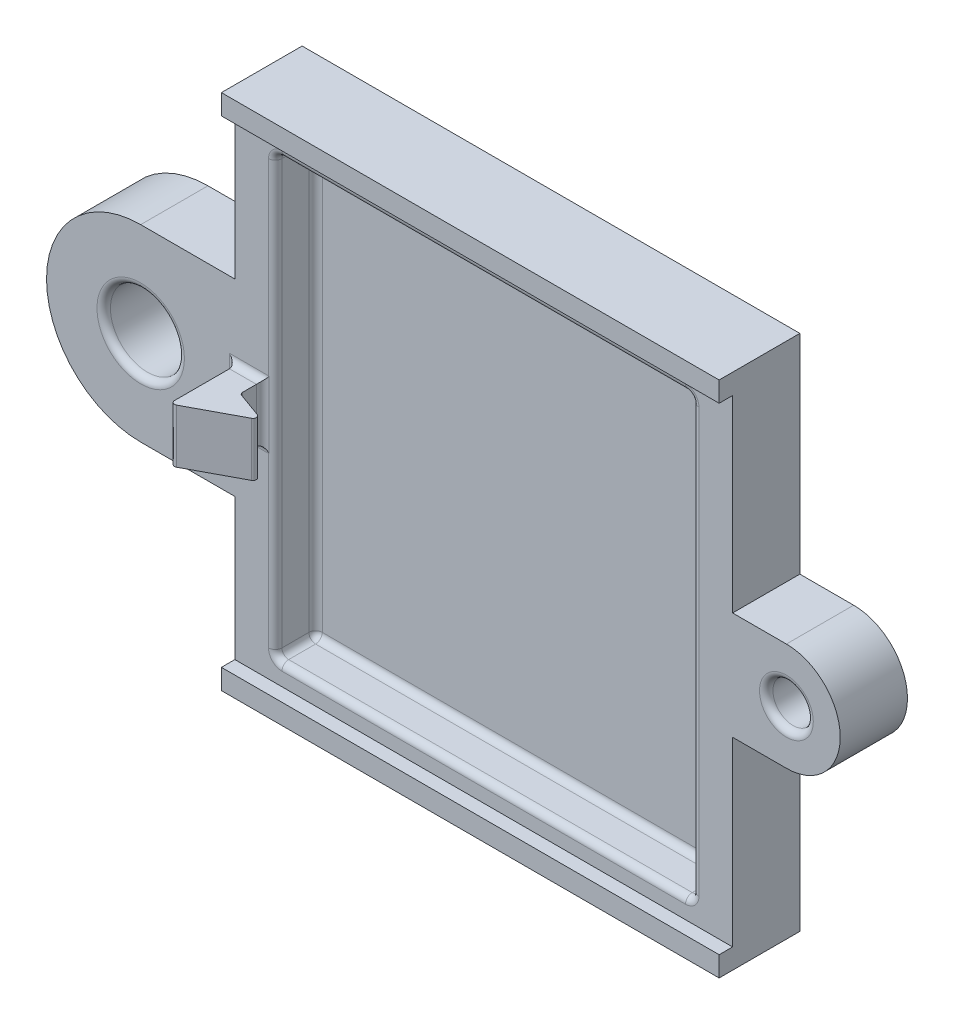
from build123d import *

# Parameters (mm, degrees)
SKETCH1_W                = 38.5
SKETCH1_H                = 37
BOSS_EXTRUDE1_DEPTH      = 5
SKETCH2_W                = 31
SKETCH2_H                = 32.5
CUT_EXTRUDE1_DEPTH       = 3
SKETCH9_R                = 1.5
SKETCH9_R_2              = 2.75
BOSS_EXTRUDE4_DEPTH      = 5
SKETCH10_W               = 37
SKETCH10_H               = 1.5
BOSS_EXTRUDE5_DEPTH      = 1
BOSS_EXTRUDE7_DEPTH      = 1.5
BOSS_EXTRUDE7_DEPTH_BACK = 2.5
FILLET2_R                = 0.5
FILLET4_R                = 0.5
FILLET7_R                = 0.5
FILLET10_R               = 0.5
FILLET11_R               = 0.5
FILLET12_R               = 0.5


with BuildPart() as part:
    # Sketch1 → Boss-Extrude1 (new body)
    with BuildSketch(Plane(origin=(0, 0, 0), x_dir=(0, 1, 0), z_dir=(0, 0, 1))):
        with Locations((0.230791095, 5.386953358)):
            Rectangle(SKETCH1_W, SKETCH1_H)
    extrude(amount=BOSS_EXTRUDE1_DEPTH)

    # Sketch2 → Cut-Extrude1 (cut)
    with BuildSketch(Plane.XY.offset(5)):
        with Locations((-5.386953358, 0.230791095)):
            Rectangle(SKETCH2_W, SKETCH2_H)
    extrude(amount=-CUT_EXTRUDE1_DEPTH, mode=Mode.SUBTRACT)

    # Sketch9 → Boss-Extrude4 (add)
    # profile 1 of 2: a face of its own
    with BuildSketch(Plane(origin=(0, 0, 0), x_dir=(1, 0, 0), z_dir=(0, 0, -1))):
        with BuildLine():
            Line((17.113046642, 4.019208905), (13.113046642, 4.019208905))
            Line((13.113046642, 4.019208905), (13.113046642, -3.980791095))
            Line((13.113046642, -3.980791095), (17.113046642, -3.980791095))
            ThreePointArc((17.113046642, -3.980791095), (21.113046642, 0.019208905), (17.113046642, 4.019208905))
        make_face()
        with Locations(Location((17.113046642, 0.019208905, 0), (0, 0, 180))):
            Circle(SKETCH9_R, mode=Mode.SUBTRACT)
    # profile 2 of 2: a face of its own
    with BuildSketch(Plane(origin=(0, 0, 0), x_dir=(1, 0, 0), z_dir=(0, 0, -1))):
        with BuildLine():
            Line((-30.886953358, 7.019208905), (-23.886953358, 7.019208905))
            Line((-23.886953358, 7.019208905), (-23.886953358, -6.980791095))
            Line((-23.886953358, -6.980791095), (-30.886953358, -6.980791095))
            ThreePointArc((-30.886953358, -6.980791095), (-37.886953358, 0.019208905), (-30.886953358, 7.019208905))
        make_face()
        with Locations(Location((-30.886953358, 0.019208905, 0), (0, 0, 180))):
            Circle(SKETCH9_R_2, mode=Mode.SUBTRACT)
    extrude(amount=-BOSS_EXTRUDE4_DEPTH)

    # Sketch10 → Boss-Extrude5 (add)
    with BuildSketch(Plane.XY.offset(5)):
        with Locations((-5.386953358, 18.730791095)):
            Rectangle(SKETCH10_W, SKETCH10_H)
        with Locations((-5.386953358, -18.269208905)):
            Rectangle(SKETCH10_W, SKETCH10_H)
    extrude(amount=BOSS_EXTRUDE5_DEPTH)

    # Sketch12 → Boss-Extrude7 (add, two sides: drawn at the far end of the back side and taken through both)
    with BuildSketch(Plane(origin=(0, 0, 0), x_dir=(-1, 0, 0), z_dir=(0, 1, 0)).offset(-BOSS_EXTRUDE7_DEPTH_BACK)):
        with BuildLine():
            Line((21.786953358, 6.524293395), (21.786953358, 5))
            Line((21.786953358, 5), (23.786953358, 5))
            Line((23.786953358, 5), (23.786953358, 9.583333333))
            ThreePointArc((23.786953358, 9.583333333), (23.665577297, 9.797706565), (23.4193063, 9.803921569))
            Line((23.4193063, 9.803921569), (19.783903246, 7.86503994))
            ThreePointArc((19.783903246, 7.86503994), (19.652201642, 7.626417165), (19.816870437, 7.409229852))
            Line((19.816870437, 7.409229852), (21.621633225, 6.759515248))
            ThreePointArc((21.621633225, 6.759515248), (21.741489378, 6.668046714), (21.786953358, 6.524293395))
        make_face()
    extrude(amount=BOSS_EXTRUDE7_DEPTH + BOSS_EXTRUDE7_DEPTH_BACK)

    # Fillet2
    fillet2_edges = [part.edges().sort_by_distance(p)[0] for p in [
        (18.613046642, -0.019208905, 5),
    ]]
    fillet(fillet2_edges, radius=FILLET2_R)

    # Fillet4
    fillet4_edges = [part.edges().sort_by_distance(p)[0] for p in [
        (-20.886953358, 0.230791095, 2),
        (-20.886953358, -16.019208905, 3.5),
        (-5.386953358, 16.480791095, 2),
        (-20.886953358, 16.480791095, 3.5),
        (10.113046642, 0.230791095, 2),
        (10.113046642, 16.480791095, 3.5),
        (-5.386953358, -16.019208905, 2),
        (10.113046642, -16.019208905, 3.5),
        (-20.886953358, 0.230791095, 5),
        (-5.386953358, -16.019208905, 5),
        (10.113046642, 0.230791095, 5),
        (-5.386953358, 16.480791095, 5),
    ]]
    fillet(fillet4_edges, radius=FILLET4_R)

    # Fillet7
    # the kernel refuses this fillet: 0.5 mm, written as the material it adds along each edge
    with BuildSketch(Plane(origin=(-23.786953358, -2.5, 5), x_dir=(-1, 0, 0), z_dir=(0, 1, 0))) as fillet7_piece_1:
        with BuildLine():
            CenterArc((FILLET7_R, FILLET7_R), FILLET7_R, 180, 90)
            Line((0, FILLET7_R), (-FILLET7_R * 0.02, FILLET7_R))
            Line((-FILLET7_R * 0.02, FILLET7_R), (-FILLET7_R * 0.02, -FILLET7_R * 0.02))
            Line((-FILLET7_R * 0.02, -FILLET7_R * 0.02), (FILLET7_R, -FILLET7_R * 0.02))
            Line((FILLET7_R, -FILLET7_R * 0.02), (FILLET7_R, 0))
        make_face()
    fillet7_piece_1_solid = extrude(amount=4, mode=Mode.PRIVATE)
    with BuildSketch(Plane(origin=(-21.786953358, -2.5, 5), x_dir=(0, -1, 0), z_dir=(-1, 0, 0))) as fillet7_piece_2:
        with BuildLine():
            CenterArc((FILLET7_R, FILLET7_R), FILLET7_R, 180, 90)
            Line((0, FILLET7_R), (-FILLET7_R * 0.02, FILLET7_R))
            Line((-FILLET7_R * 0.02, FILLET7_R), (-FILLET7_R * 0.02, -FILLET7_R * 0.02))
            Line((-FILLET7_R * 0.02, -FILLET7_R * 0.02), (FILLET7_R, -FILLET7_R * 0.02))
            Line((FILLET7_R, -FILLET7_R * 0.02), (FILLET7_R, 0))
        make_face()
    fillet7_piece_2_solid = extrude(amount=2, mode=Mode.PRIVATE)
    with BuildSketch(Plane(origin=(-21.786953358, -2.5, 5), x_dir=(0.9999844906159053, 0, -0.005569427946243513), z_dir=(0, 1, 0))) as fillet7_piece_3:
        with BuildLine():
            CenterArc((0.497235448, -0.497764474), FILLET7_R, 95.420064112, 84.260829523)
            Line((-0.002756797, -0.49497976), (-0.052756021, -0.494701289))
            Line((-0.052756021, -0.494701289), (-0.049999225, 0.000278471))
            Line((-0.049999225, 0.000278471), (0.000278471, 0.049999225))
            ThreePointArc((0.000278471, 0.049999225), (0.400272268, 0.047771453), (0.445284132, 0.049776447))
            Line((0.445284132, 0.049776447), (0.450006979, 0))
        make_face()
    fillet7_piece_3_solid = extrude(amount=4, mode=Mode.PRIVATE)
    with BuildSketch(Plane(origin=(-21.786953358, 1.5, 5), x_dir=(0, 1, 0), z_dir=(-1, 0, 0))) as fillet7_piece_4:
        with BuildLine():
            CenterArc((FILLET7_R, -FILLET7_R), FILLET7_R, 90, 90)
            Line((0, -FILLET7_R), (-FILLET7_R * 0.02, -FILLET7_R))
            Line((-FILLET7_R * 0.02, -FILLET7_R), (-FILLET7_R * 0.02, FILLET7_R * 0.02))
            Line((-FILLET7_R * 0.02, FILLET7_R * 0.02), (FILLET7_R, FILLET7_R * 0.02))
            Line((FILLET7_R, FILLET7_R * 0.02), (FILLET7_R, 0))
        make_face()
    fillet7_piece_4_solid = extrude(amount=2, mode=Mode.PRIVATE)
    with BuildSketch(Plane(origin=(-21.786953358, -2.5, 5), x_dir=(0, -1, 0), z_dir=(-1, 0, 0))) as fillet7_piece_5a_section:
        with BuildLine():
            CenterArc((FILLET7_R, FILLET7_R), FILLET7_R, 180, 90)
            Line((0, FILLET7_R), (-FILLET7_R * 0.02, FILLET7_R))
            Line((-FILLET7_R * 0.02, FILLET7_R), (-FILLET7_R * 0.02, -FILLET7_R * 0.02))
            Line((-FILLET7_R * 0.02, -FILLET7_R * 0.02), (FILLET7_R, -FILLET7_R * 0.02))
            Line((FILLET7_R, -FILLET7_R * 0.02), (FILLET7_R, 0))
        make_face()
    fillet7_piece_5a = extrude(amount=3.25, mode=Mode.PRIVATE)
    fillet7_piece_5a = split(fillet7_piece_5a, bisect_by=Plane(origin=(-23.786953358, -2.613197557, 5.113197557), z_dir=(-1, 0, 0)), keep=Keep.TOP, mode=Mode.PRIVATE)
    with BuildSketch(Plane(origin=(-23.786953358, -3.75, 5), x_dir=(-1, 0, 0), z_dir=(0, 1, 0))) as fillet7_piece_5b_section:
        with BuildLine():
            CenterArc((FILLET7_R, FILLET7_R), FILLET7_R, 180, 90)
            Line((0, FILLET7_R), (-FILLET7_R * 0.02, FILLET7_R))
            Line((-FILLET7_R * 0.02, FILLET7_R), (-FILLET7_R * 0.02, -FILLET7_R * 0.02))
            Line((-FILLET7_R * 0.02, -FILLET7_R * 0.02), (FILLET7_R, -FILLET7_R * 0.02))
            Line((FILLET7_R, -FILLET7_R * 0.02), (FILLET7_R, 0))
        make_face()
    fillet7_piece_5b = extrude(amount=5.25, mode=Mode.PRIVATE)
    fillet7_piece_5b = split(fillet7_piece_5b, bisect_by=Plane(origin=(-23.900150915, -2.5, 5.113197557), z_dir=(0, -1, 0)), keep=Keep.TOP, mode=Mode.PRIVATE)
    fillet7_piece_5 = fillet7_piece_5a & fillet7_piece_5b
    with BuildSketch(Plane(origin=(-23.786953358, -2.5, 5), x_dir=(-1, 0, 0), z_dir=(0, 1, 0))) as fillet7_piece_6a_section:
        with BuildLine():
            CenterArc((FILLET7_R, FILLET7_R), FILLET7_R, 180, 90)
            Line((0, FILLET7_R), (-FILLET7_R * 0.02, FILLET7_R))
            Line((-FILLET7_R * 0.02, FILLET7_R), (-FILLET7_R * 0.02, -FILLET7_R * 0.02))
            Line((-FILLET7_R * 0.02, -FILLET7_R * 0.02), (FILLET7_R, -FILLET7_R * 0.02))
            Line((FILLET7_R, -FILLET7_R * 0.02), (FILLET7_R, 0))
        make_face()
    fillet7_piece_6a = extrude(amount=5.25, mode=Mode.PRIVATE)
    fillet7_piece_6a = split(fillet7_piece_6a, bisect_by=Plane(origin=(-23.900150915, 1.5, 5.113197557), z_dir=(0, 1, 0)), keep=Keep.TOP, mode=Mode.PRIVATE)
    with BuildSketch(Plane(origin=(-21.786953358, 1.5, 5), x_dir=(0, 1, 0), z_dir=(-1, 0, 0))) as fillet7_piece_6b_section:
        with BuildLine():
            CenterArc((FILLET7_R, -FILLET7_R), FILLET7_R, 90, 90)
            Line((0, -FILLET7_R), (-FILLET7_R * 0.02, -FILLET7_R))
            Line((-FILLET7_R * 0.02, -FILLET7_R), (-FILLET7_R * 0.02, FILLET7_R * 0.02))
            Line((-FILLET7_R * 0.02, FILLET7_R * 0.02), (FILLET7_R, FILLET7_R * 0.02))
            Line((FILLET7_R, FILLET7_R * 0.02), (FILLET7_R, 0))
        make_face()
    fillet7_piece_6b = extrude(amount=3.25, mode=Mode.PRIVATE)
    fillet7_piece_6b = split(fillet7_piece_6b, bisect_by=Plane(origin=(-23.786953358, 1.613197557, 5.113197557), z_dir=(-1, 0, 0)), keep=Keep.TOP, mode=Mode.PRIVATE)
    fillet7_piece_6 = fillet7_piece_6a & fillet7_piece_6b
    with BuildSketch(Plane(origin=(-20.536953358, -2.5, 5), x_dir=(0, -1, 0), z_dir=(-1, 0, 0))) as fillet7_piece_7a_section:
        with BuildLine():
            CenterArc((FILLET7_R, FILLET7_R), FILLET7_R, 180, 90)
            Line((0, FILLET7_R), (-FILLET7_R * 0.02, FILLET7_R))
            Line((-FILLET7_R * 0.02, FILLET7_R), (-FILLET7_R * 0.02, -FILLET7_R * 0.02))
            Line((-FILLET7_R * 0.02, -FILLET7_R * 0.02), (FILLET7_R, -FILLET7_R * 0.02))
            Line((FILLET7_R, -FILLET7_R * 0.02), (FILLET7_R, 0))
        make_face()
    fillet7_piece_7a = extrude(amount=3.25, mode=Mode.PRIVATE)
    fillet7_piece_7a = split(fillet7_piece_7a, bisect_by=Plane(origin=(-21.786953358, -2.613197557, 5.113197557), z_dir=(1, 0, 0)), keep=Keep.TOP, mode=Mode.PRIVATE)
    with BuildSketch(Plane(origin=(-21.786953358, -3.737468593, 5), x_dir=(0.9999844906159053, 0, -0.00556942794624154), z_dir=(0, 1, 0))) as fillet7_piece_7b_section:
        with BuildLine():
            CenterArc((0.497235448, -0.497764474), FILLET7_R, 95.420064112, 84.260829523)
            Line((-0.002756797, -0.49497976), (-0.052756021, -0.494701289))
            Line((-0.052756021, -0.494701289), (-0.049999225, 0.000278471))
            Line((-0.049999225, 0.000278471), (0.000278471, 0.049999225))
            ThreePointArc((0.000278471, 0.049999225), (0.400272268, 0.047771453), (0.445284132, 0.049776447))
            Line((0.445284132, 0.049776447), (0.450006979, 0))
        make_face()
    fillet7_piece_7b = extrude(amount=5.237468593, mode=Mode.PRIVATE)
    fillet7_piece_7b = split(fillet7_piece_7b, bisect_by=Plane(origin=(-21.689393004, -2.5, 5.114923371), z_dir=(0, -1, 0)), keep=Keep.TOP, mode=Mode.PRIVATE)
    fillet7_piece_7 = fillet7_piece_7a & fillet7_piece_7b
    with BuildSketch(Plane(origin=(-20.536953358, 1.5, 5), x_dir=(0, 1, 0), z_dir=(-1, 0, 0))) as fillet7_piece_8a_section:
        with BuildLine():
            CenterArc((FILLET7_R, -FILLET7_R), FILLET7_R, 90, 90)
            Line((0, -FILLET7_R), (-FILLET7_R * 0.02, -FILLET7_R))
            Line((-FILLET7_R * 0.02, -FILLET7_R), (-FILLET7_R * 0.02, FILLET7_R * 0.02))
            Line((-FILLET7_R * 0.02, FILLET7_R * 0.02), (FILLET7_R, FILLET7_R * 0.02))
            Line((FILLET7_R, FILLET7_R * 0.02), (FILLET7_R, 0))
        make_face()
    fillet7_piece_8a = extrude(amount=3.25, mode=Mode.PRIVATE)
    fillet7_piece_8a = split(fillet7_piece_8a, bisect_by=Plane(origin=(-21.786953358, 1.613197557, 5.113197557), z_dir=(1, 0, 0)), keep=Keep.TOP, mode=Mode.PRIVATE)
    with BuildSketch(Plane(origin=(-21.786953358, -2.5, 5), x_dir=(0.9999844906159053, 0, -0.005569427946243513), z_dir=(0, 1, 0))) as fillet7_piece_8b_section:
        with BuildLine():
            CenterArc((0.497235448, -0.497764474), FILLET7_R, 95.420064112, 84.260829523)
            Line((-0.002756797, -0.49497976), (-0.052756021, -0.494701289))
            Line((-0.052756021, -0.494701289), (-0.049999225, 0.000278471))
            Line((-0.049999225, 0.000278471), (0.000278471, 0.049999225))
            ThreePointArc((0.000278471, 0.049999225), (0.400272268, 0.047771453), (0.445284132, 0.049776447))
            Line((0.445284132, 0.049776447), (0.450006979, 0))
        make_face()
    fillet7_piece_8b = extrude(amount=5.237468593, mode=Mode.PRIVATE)
    fillet7_piece_8b = split(fillet7_piece_8b, bisect_by=Plane(origin=(-21.689393004, 1.5, 5.114923371), z_dir=(0, 1, 0)), keep=Keep.TOP, mode=Mode.PRIVATE)
    fillet7_piece_8 = fillet7_piece_8a & fillet7_piece_8b
    add([fillet7_piece_1_solid, fillet7_piece_2_solid, fillet7_piece_3_solid, fillet7_piece_4_solid, fillet7_piece_5, fillet7_piece_6, fillet7_piece_7, fillet7_piece_8])

    # Fillet10
    fillet10_edges = [part.edges().sort_by_distance(p)[0] for p in [
        (-28.136953358, -0.019208905, 5),
    ]]
    fillet(fillet10_edges, radius=FILLET10_R)

    # Fillet11
    fillet11_edges = [part.edges().sort_by_distance(p)[0] for p in [
        (18.613046642, -0.019208905, 0),
    ]]
    fillet(fillet11_edges, radius=FILLET11_R)

    # Fillet12
    fillet12_edges = [part.edges().sort_by_distance(p)[0] for p in [
        (-28.136953358, -0.019208905, 0),
    ]]
    fillet(fillet12_edges, radius=FILLET12_R)


solid = part.part
